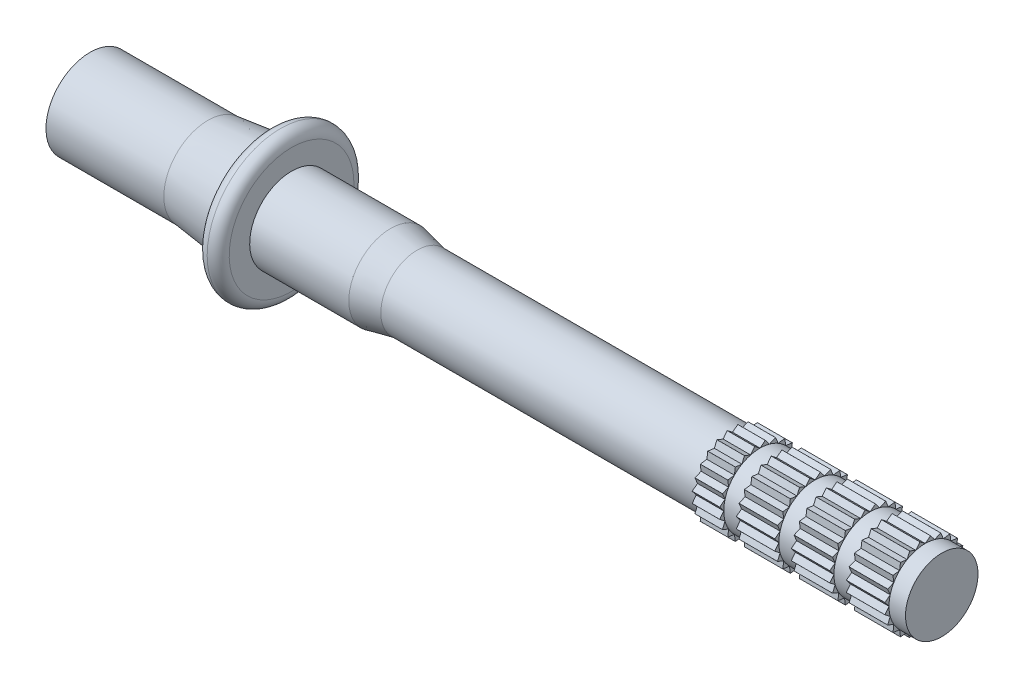
from build123d import *

# Parameters (mm, degrees)
KES_EKSTR_ZYON2_DEPTH   = 10
DAIRESEL_KAPLAMA1_COUNT = 24
IZIM3_OUTSIDE_W         = 16.622
IZIM3_OUTSIDE_H         = 16.622
IZIM3_OUTSIDE_R         = 1.646333965
KES_EKSTR_ZYON3_DEPTH   = 0.75
L_O_ALTMA1_COUNT        = 4
L_O_ALTMA1_PITCH        = 2.5
RADYUS1_R               = 0.5


with BuildPart() as part:
    # Çizim1 → Döndür1 (revolve)
    with BuildSketch(Plane.XY):
        Polygon((0, 0), (0, 2), (5.35, 2), (8.15, 2.331401839), (8.15, 3.331401839), (9.15, 3.331401839), (9.15, 1.901401839), (13.65, 1.901401839), (14.85, 1.646333965), (29.17, 1.646333965), (29.17, 1.846333965), (38.67, 1.846333965), (38.67, 0), align=None)
    revolve(axis=Axis((38.67, 0, 0), (-1, 0, 0)))

    # Çizim2 → Kes-Ekstrüzyon2 (cut)
    with BuildSketch(Plane(origin=(38.67, 0, 0), x_dir=(0, 0, -1), z_dir=(1, 0, 0))):
        with BuildLine():
            Line((-0.240196544, 1.830643256), (0, 1.646333965))
            Line((0, 1.646333965), (0.240196544, 1.830643256))
            ThreePointArc((0.240196544, 1.830643256), (0, 1.901401839), (-0.240196544, 1.830643256))
        make_face()
    kes_ekstr_zyon2 = extrude(amount=-KES_EKSTR_ZYON2_DEPTH, mode=Mode.SUBTRACT)

    # Dairesel Kaplama1: Kes-Ekstrüzyon2 ×24 about axis
    dairesel_kaplama1_axis = Axis((0, 0, 0), (1, 0, 0))
    for i in range(1, DAIRESEL_KAPLAMA1_COUNT):
        add(kes_ekstr_zyon2.rotate(dairesel_kaplama1_axis, i * 360 / DAIRESEL_KAPLAMA1_COUNT), mode=Mode.SUBTRACT)

    # Çizim3 outside → Kes-Ekstrüzyon3 (cut)
    with BuildSketch(Plane(origin=(38.67, 0, 0), x_dir=(0, 0, -1), z_dir=(1, 0, 0))):
        Rectangle(IZIM3_OUTSIDE_W, IZIM3_OUTSIDE_H)
        with Locations(Location((0, 0, 0), (0, 0, 90))):
            Circle(IZIM3_OUTSIDE_R, mode=Mode.SUBTRACT)
    kes_ekstr_zyon3 = extrude(amount=-KES_EKSTR_ZYON3_DEPTH, mode=Mode.SUBTRACT)

    # LÇoğaltma1: Kes-Ekstrüzyon3 ×4
    with Locations(*[(-i * L_O_ALTMA1_PITCH, 0, 0) for i in range(1, L_O_ALTMA1_COUNT)]):
        add(kes_ekstr_zyon3, mode=Mode.SUBTRACT)

    # Radyus1
    radyus1_edges = [part.edges().sort_by_distance(p)[0] for p in [
        (9.15, -3.331401839, 0),
        (8.15, -3.331401839, 0),
    ]]
    fillet(radyus1_edges, radius=RADYUS1_R - 0.0001)  # a hair under: the kernel refuses the full size


solid = part.part
